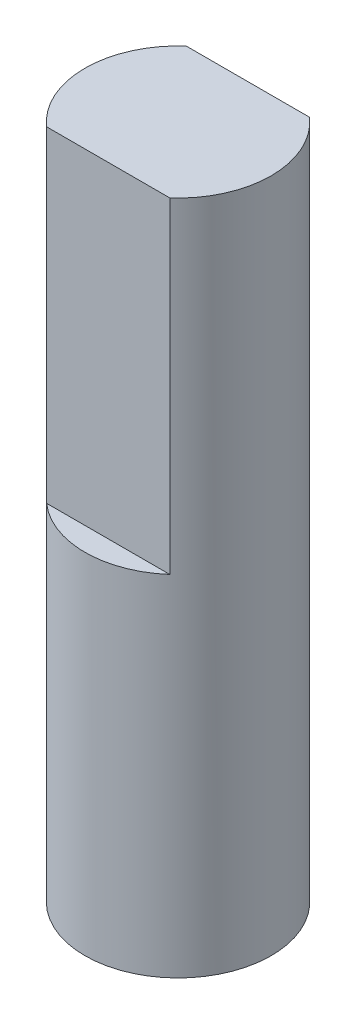
from build123d import *

# Parameters (mm, degrees)
CROQUIS1_R              = 4
SALIENTE_EXTRUIR1_DEPTH = 15
SALIENTE_EXTRUIR2_DEPTH = 14


with BuildPart() as part:
    # Croquis1 → Saliente-Extruir1 (new body)
    with BuildSketch(Plane(origin=(0, 0, 0), x_dir=(1, 0, 0), z_dir=(0, 1, 0))):
        Circle(CROQUIS1_R)
    extrude(amount=SALIENTE_EXTRUIR1_DEPTH)

    # Croquis2 → Saliente-Extruir2 (add)
    with BuildSketch(Plane(origin=(0, 15, 0), x_dir=(1, 0, 0), z_dir=(0, 1, 0))):
        with BuildLine():
            Line((-2.645751311, -3), (2.645751311, -3))
            ThreePointArc((2.645751311, -3), (4, 0), (2.645751311, 3))
            Line((2.645751311, 3), (-2.645751311, 3))
            ThreePointArc((-2.645751311, 3), (-4, 0), (-2.645751311, -3))
        make_face()
    extrude(amount=SALIENTE_EXTRUIR2_DEPTH)


solid = part.part
